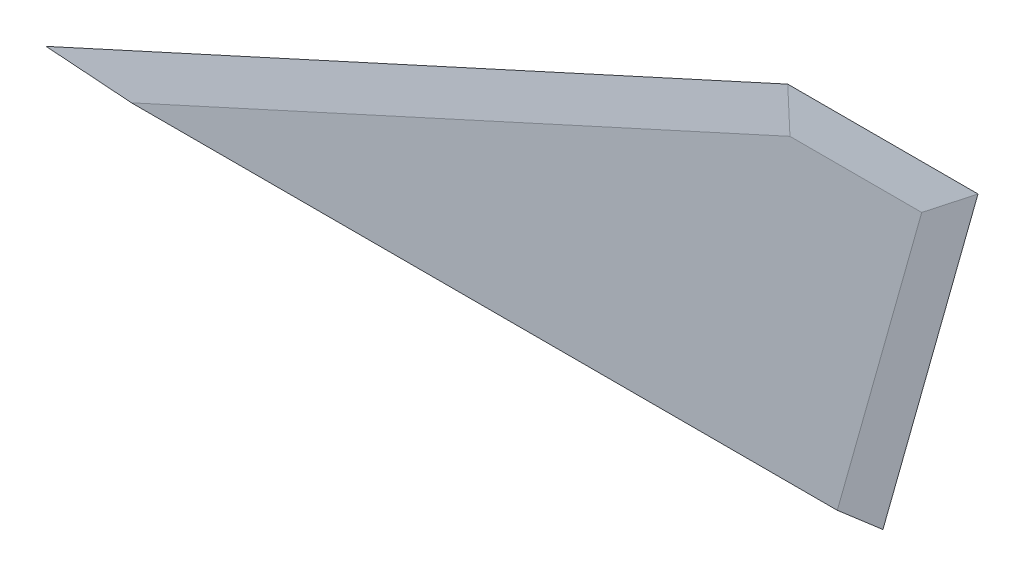
from build123d import *
from OCP.BRepFilletAPI import BRepFilletAPI_MakeChamfer

# Parameters (mm, degrees)
BOSS_EXTRUDE1_DEPTH = 1.59
CHAMFER1_SIZE       = 1.59
CHAMFER1_SIZE2      = 10
CHAMFER2_SIZE       = 10
CHAMFER2_SIZE_2     = 1.59
SKETCH2_R           = 41
CUT_EXTRUDE1_DEPTH  = 220


with BuildPart() as part:
    # Sketch1 → Boss-Extrude1 (new, symmetric)
    with BuildSketch(Plane.XY):
        Polygon((0, 0), (220, 0), (245, 88.9), (195, 88.9), align=None)
    extrude(amount=BOSS_EXTRUDE1_DEPTH, both=True)

    # Chamfer1: one chamfer whose edges measure the first distance from different faces: ONE call of the kernel's chamfer builder (chamfer() names one face for all edges)
    chamfer1_edges_1 = [part.edges().sort_by_distance(p)[0] for p in [
        (232.5, 44.45, 1.59),
    ]]
    chamfer1_side_1 = [part.faces().sort_by_distance(p)[0] for p in [
        (232.5, 44.45, 0),
    ]]
    chamfer1_edges_2 = [part.edges().sort_by_distance(p)[0] for p in [
        (220, 88.9, 1.59),
    ]]
    chamfer1_side_2 = [part.faces().sort_by_distance(p)[0] for p in [
        (220, 88.9, 0),
    ]]
    chamfer1_edges_3 = [part.edges().sort_by_distance(p)[0] for p in [
        (97.5, 44.45, 1.59),
    ]]
    chamfer1_side_3 = [part.faces().sort_by_distance(p)[0] for p in [
        (97.5, 44.45, 0),
    ]]
    chamfer1 = BRepFilletAPI_MakeChamfer(part.part.solid().wrapped)
    for e in chamfer1_edges_1:
        chamfer1.Add(CHAMFER1_SIZE, CHAMFER1_SIZE2, e.wrapped, chamfer1_side_1[0].wrapped)  # the first distance lies on this face
    for e in chamfer1_edges_2:
        chamfer1.Add(CHAMFER1_SIZE, CHAMFER1_SIZE2, e.wrapped, chamfer1_side_2[0].wrapped)  # the first distance lies on this face
    for e in chamfer1_edges_3:
        chamfer1.Add(CHAMFER1_SIZE, CHAMFER1_SIZE2, e.wrapped, chamfer1_side_3[0].wrapped)  # the first distance lies on this face
    add(Compound.cast(chamfer1.Shape()), mode=Mode.REPLACE)

    # Chamfer2
    # the kernel refuses this chamfer: 10, 1.59 mm, written as the material it takes off along each edge
    with BuildSketch(Plane(origin=(218.64660826, 99.680428074, -1.59), x_dir=(0.41481463774773214, -0.9098858758246093, -0.006042291378384615), z_dir=(-0.9099024859208529, -0.41482221024801963, 0))) as chamfer2_piece_1:
        Polygon((CHAMFER2_SIZE * 0.999981745191, CHAMFER2_SIZE * 0.00604229137838), (-CHAMFER2_SIZE_2 * 0.00604229137839, CHAMFER2_SIZE_2 * 0.999981745191), (0, 0), align=None)
    extrude(amount=266.284816527, mode=Mode.SUBTRACT)
    with BuildSketch(Plane(origin=(270.98806864, 88.9, -1.59), x_dir=(0, -0.9999817451908304, -0.006042291378384616), z_dir=(-1, 0, 0))) as chamfer2_piece_2:
        Polygon((CHAMFER2_SIZE * 0.999981745191, CHAMFER2_SIZE * 0.00604229137838), (-CHAMFER2_SIZE_2 * 0.00604229137838, CHAMFER2_SIZE_2 * 0.999981745191), (0, 0), align=None)
    extrude(amount=101.976137281, mode=Mode.SUBTRACT)
    with BuildSketch(Plane(origin=(212.96466032, -25.017667902, -1.59), x_dir=(0.22378185481817084, -0.06293078032007055, 0.9726054690070615), z_dir=(0.2707142180235852, 0.9626597592918689, 0))) as chamfer2_piece_3:
        Polygon((CHAMFER2_SIZE_2 * 0.972605469007, -CHAMFER2_SIZE_2 * 0.232462043477), (-CHAMFER2_SIZE * 0.232462043477, -CHAMFER2_SIZE * 0.972605469007), (0, 0), align=None)
    extrude(amount=144.324445333, mode=Mode.SUBTRACT)

    # Sketch2 → Cut-Extrude1 (cut)
    with BuildSketch(Plane(origin=(0, 0, 0), x_dir=(0, 0, -1), z_dir=(1, 0, 0))):
        with Locations((0, -40.969157912)):
            Circle(SKETCH2_R)
    extrude(amount=CUT_EXTRUDE1_DEPTH, mode=Mode.SUBTRACT)


solid = part.part
